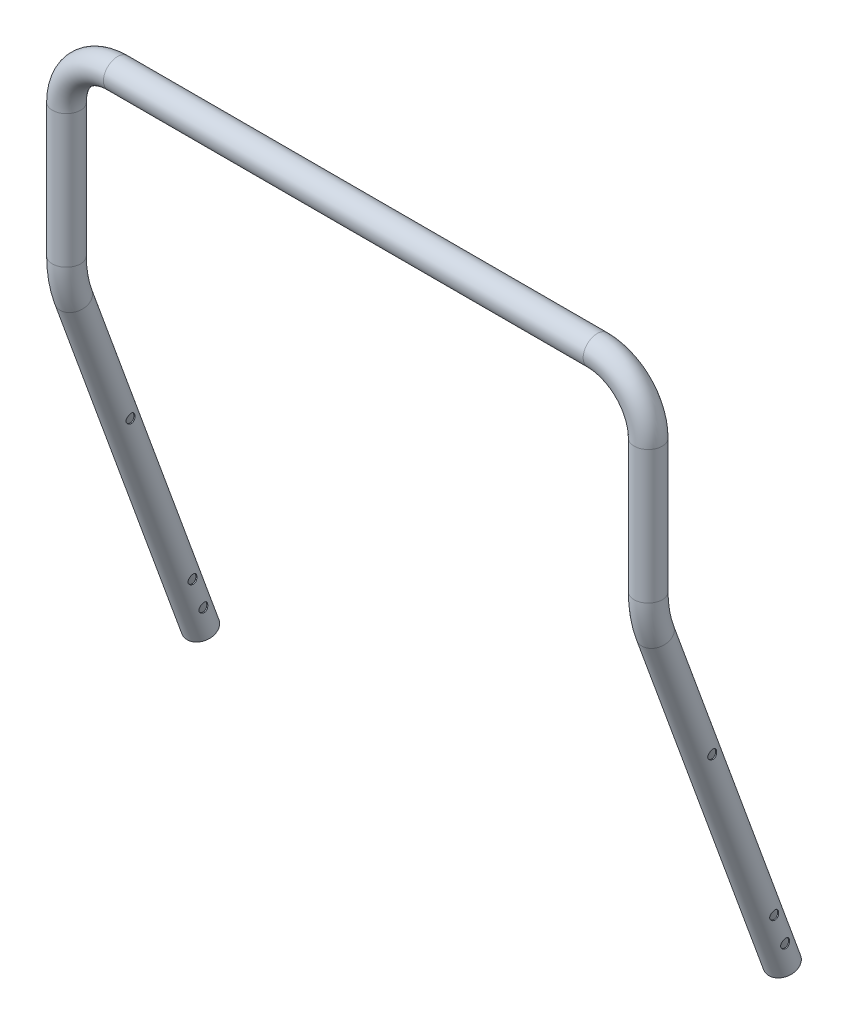
from build123d import *

# Parameters (mm, degrees)
SKETCH9_R                      = 11
SKETCH9_R_2                    = 10.2
SKETCH9_2_R                    = 11
SKETCH9_2_R_2                  = 10.2
CUT_EXTRUDE1_REACH             = 662.264
SKETCH14_R                     = 3.5
CUT_EXTRUDE1_DIRECTION_2_REACH = 662.264


with BuildPart() as part:
    # Sweep2: sweep along a path in Sketch8
    with BuildLine(Plane.XY) as sweep2_path:
        Line((-228, -100), (-228, -40))
        ThreePointArc((-228, -40), (-216.284271247, -11.715728753), (-188, 0))
        Line((-188, 0), (188, 0))
        ThreePointArc((188, 0), (216.284271247, -11.715728753), (228, -40))
        Line((228, -40), (228, -100))
    # Sketch9 → Sweep2 (sweep)
    with BuildSketch(Plane(origin=(228, -100, 0), x_dir=(-1, 0, 0), z_dir=(0, -1, 0))):
        Circle(SKETCH9_R)
        Circle(SKETCH9_R_2, mode=Mode.SUBTRACT)
    sweep(path=sweep2_path.line)

    # Sweep3: sweep along a path in Sketch13
    with BuildLine(Plane(origin=(228, 0, 0), x_dir=(0, 0, -1), z_dir=(1, 0, 0))) as sweep3_path:
        Line((0, -100), (0, -144.259708793))
        ThreePointArc((0, -144.259708793), (1.367302229, -159.888044783), (5.427664129, -175.041521693))
        Line((5.427664129, -175.041521693), (104.967762343, -448.525693866))
    # Sketch9<2> → Sweep3 (sweep)
    with BuildSketch(Plane(origin=(228, -100, 0), x_dir=(-1, 0, 0), z_dir=(0, -1, 0))):
        Circle(SKETCH9_2_R)
        Circle(SKETCH9_2_R_2, mode=Mode.SUBTRACT)
    sweep3 = sweep(path=sweep3_path.line)

    # Mirror1: Sweep3 across plane
    add(sweep3.mirror(Plane(origin=(0, 0, 0), x_dir=(0, 0, 1), z_dir=(1, 0, 0))))

    # Sketch14 → Cut-Extrude1 (cut, up to next)
    with BuildSketch(Plane(origin=(228, 0, 0), x_dir=(0, 0, -1), z_dir=(1, 0, 0)), mode=Mode.PRIVATE) as cut_extrude1_sk1:
        with Locations((39.659649746, -269.093129199)):
            Circle(SKETCH14_R)
    cut_extrude1_tool1 = extrude(cut_extrude1_sk1.sketch, amount=-CUT_EXTRUDE1_REACH, mode=Mode.PRIVATE) & part.part
    # Sketch14 → Cut-Extrude1 (cut, up to next)
    with BuildSketch(Plane(origin=(228, 0, 0), x_dir=(0, 0, -1), z_dir=(1, 0, 0)), mode=Mode.PRIVATE) as cut_extrude1_sk2:
        with Locations((88.226510099, -402.52948135)):
            Circle(SKETCH14_R)
    cut_extrude1_tool2 = extrude(cut_extrude1_sk2.sketch, amount=-CUT_EXTRUDE1_REACH, mode=Mode.PRIVATE) & part.part
    # Sketch14 → Cut-Extrude1 (cut, up to next)
    with BuildSketch(Plane(origin=(228, 0, 0), x_dir=(0, 0, -1), z_dir=(1, 0, 0)), mode=Mode.PRIVATE) as cut_extrude1_sk3:
        with Locations((96.777013682, -426.02179687)):
            Circle(SKETCH14_R)
    cut_extrude1_tool3 = extrude(cut_extrude1_sk3.sketch, amount=-CUT_EXTRUDE1_REACH, mode=Mode.PRIVATE) & part.part
    cut_extrude1_1 = cut_extrude1_tool1.solids().sort_by_distance((228, -269.093129, -39.65965))[0]
    add(cut_extrude1_1, mode=Mode.SUBTRACT)
    cut_extrude1_2 = cut_extrude1_tool2.solids().sort_by_distance((228, -402.529481, -88.22651))[0]
    add(cut_extrude1_2, mode=Mode.SUBTRACT)
    cut_extrude1_3 = cut_extrude1_tool3.solids().sort_by_distance((228, -426.021797, -96.777014))[0]
    add(cut_extrude1_3, mode=Mode.SUBTRACT)
    cut_extrude1 = cut_extrude1_1 + cut_extrude1_2 + cut_extrude1_3  # Cut-Extrude1 as one shape, for the pattern or mirror that repeats it

    # Sketch14 → Cut-Extrude1 direction 2 (cut, up to next)
    with BuildSketch(Plane(origin=(228, 0, 0), x_dir=(0, 0, -1), z_dir=(1, 0, 0)), mode=Mode.PRIVATE) as cut_extrude1_direction_2_sk1:
        with Locations((39.659649746, -269.093129199)):
            Circle(SKETCH14_R)
    cut_extrude1_direction_2_tool1 = extrude(cut_extrude1_direction_2_sk1.sketch, amount=CUT_EXTRUDE1_DIRECTION_2_REACH, mode=Mode.PRIVATE) & part.part
    # Sketch14 → Cut-Extrude1 direction 2 (cut, up to next)
    with BuildSketch(Plane(origin=(228, 0, 0), x_dir=(0, 0, -1), z_dir=(1, 0, 0)), mode=Mode.PRIVATE) as cut_extrude1_direction_2_sk2:
        with Locations((88.226510099, -402.52948135)):
            Circle(SKETCH14_R)
    cut_extrude1_direction_2_tool2 = extrude(cut_extrude1_direction_2_sk2.sketch, amount=CUT_EXTRUDE1_DIRECTION_2_REACH, mode=Mode.PRIVATE) & part.part
    # Sketch14 → Cut-Extrude1 direction 2 (cut, up to next)
    with BuildSketch(Plane(origin=(228, 0, 0), x_dir=(0, 0, -1), z_dir=(1, 0, 0)), mode=Mode.PRIVATE) as cut_extrude1_direction_2_sk3:
        with Locations((96.777013682, -426.02179687)):
            Circle(SKETCH14_R)
    cut_extrude1_direction_2_tool3 = extrude(cut_extrude1_direction_2_sk3.sketch, amount=CUT_EXTRUDE1_DIRECTION_2_REACH, mode=Mode.PRIVATE) & part.part
    cut_extrude1_direction_2_1 = cut_extrude1_direction_2_tool1.solids().sort_by_distance((228, -269.093129, -39.65965))[0]
    add(cut_extrude1_direction_2_1, mode=Mode.SUBTRACT)
    cut_extrude1_direction_2_2 = cut_extrude1_direction_2_tool2.solids().sort_by_distance((228, -402.529481, -88.22651))[0]
    add(cut_extrude1_direction_2_2, mode=Mode.SUBTRACT)
    cut_extrude1_direction_2_3 = cut_extrude1_direction_2_tool3.solids().sort_by_distance((228, -426.021797, -96.777014))[0]
    add(cut_extrude1_direction_2_3, mode=Mode.SUBTRACT)
    cut_extrude1_direction_2 = cut_extrude1_direction_2_1 + cut_extrude1_direction_2_2 + cut_extrude1_direction_2_3  # Cut-Extrude1 direction 2 as one shape, for the pattern or mirror that repeats it

    # Mirror2: Cut-Extrude1, Cut-Extrude1 direction 2 across plane
    add(cut_extrude1.mirror(Plane(origin=(0, 0, 0), x_dir=(0, 0, 1), z_dir=(1, 0, 0))), mode=Mode.SUBTRACT)
    add(cut_extrude1_direction_2.mirror(Plane(origin=(0, 0, 0), x_dir=(0, 0, 1), z_dir=(1, 0, 0))), mode=Mode.SUBTRACT)


solid = part.part
